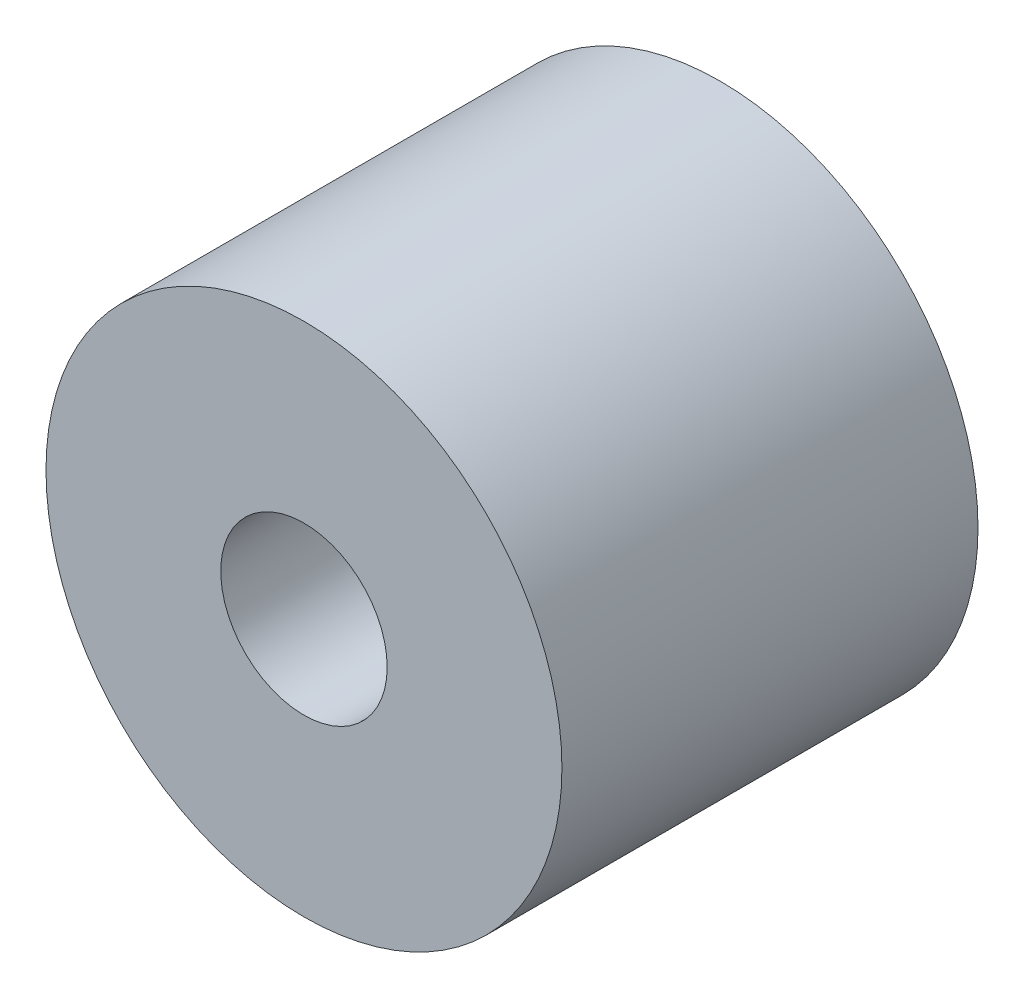
from build123d import *

# Parameters (mm, degrees)
SKETCH1_R           = 15.5
SKETCH1_R_2         = 5
BOSS_EXTRUDE1_DEPTH = 25


with BuildPart() as part:
    # Sketch1 → Boss-Extrude1 (new body)
    with BuildSketch(Plane.XY):
        Circle(SKETCH1_R)
        Circle(SKETCH1_R_2, mode=Mode.SUBTRACT)
    extrude(amount=BOSS_EXTRUDE1_DEPTH)


solid = part.part
